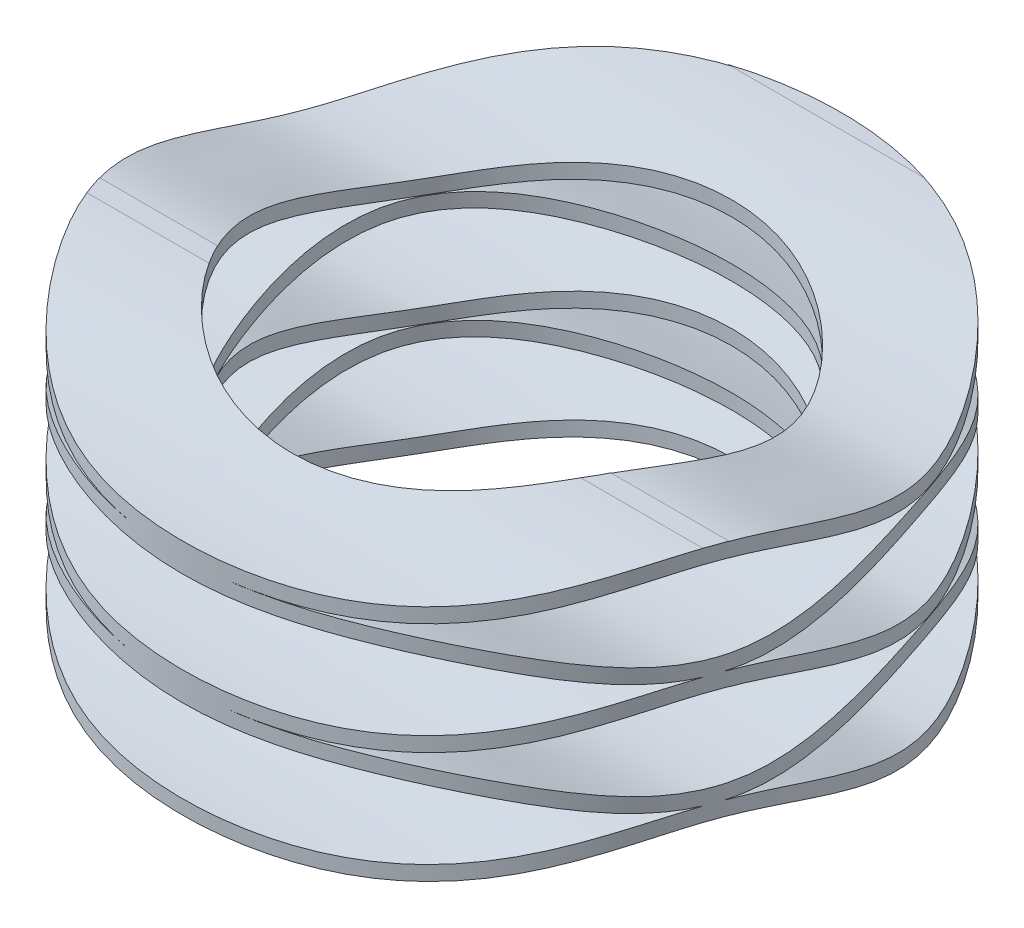
from build123d import *

# Parameters (mm, degrees)
EXTRUDE_THIN1_START       = -4.5
EXTRUDE_THIN1_DEPTH       = 9
BOSS_EXTRUDE2_DEPTH       = 4.5
LPATTERN3_COUNT           = 3
LPATTERN3_PITCH           = 1.016
BOSS_EXTRUDE1_START       = -0.254
BOSS_EXTRUDE1_OUTLINE_W   = 3.81
BOSS_EXTRUDE1_OUTLINE_H   = 0.886
BOSS_EXTRUDE1_OUTLINE_H_2 = 1.648
BOSS_EXTRUDE1_DEPTH       = 0.254
CUT_EXTRUDE1_DEPTH        = 9.775881847
CUT_EXTRUDE1_DEPTH_BACK   = 9.775881847
SKETCH8_OUTSIDE_W         = 13.404
SKETCH8_OUTSIDE_H         = 11.404
SKETCH8_OUTSIDE_R         = 3
SKETCH8_OUTSIDE_R_2       = 2
CUT_EXTRUDE2_DEPTH        = 8.368256101
CUT_EXTRUDE2_DEPTH_BACK   = 8.368256101
SKETCH12_W                = 6.3
SKETCH12_H                = 0.5334


# Read off the part's stored shape, not the designer's step: Extrude-Thin1, Boss-Extrude1
with BuildPart() as part:
    # Extrude-Thin1 outline → Extrude-Thin1 (new body)
    with BuildSketch(Plane(origin=(0, 0, 0), x_dir=(0, 0, -1), z_dir=(1, 0, 0)).offset(EXTRUDE_THIN1_START)):
        with BuildLine():
            Line((6, 0.378649941), (6.5, 0.37865))
            Line((6.5, 0.37865), (6.5, 0.50865))
            Line((6.5, 0.50865), (6, 0.508650057))
            add(Edge.make_bspline(
                [(0, 0.130000057), (0.031255668, 0.129958791), (0.060250148, 0.130722687), (0.120666581, 0.133721045), (0.211463813, 0.140424098), (0.302795129, 0.153114969), (0.48615165, 0.18475664), (0.609309778, 0.214212381), (0.981176685, 0.313261689), (1.232114678, 0.393672394), (1.613586139, 0.47508319), (1.74164001, 0.495650904), (1.999669491, 0.512852073), (2.129613487, 0.507820635), (2.514757352, 0.459828306), (2.76771547, 0.387536187), (3.267679852, 0.245552527), (3.514717016, 0.175846286), (3.879626865, 0.130647832), (3.999717701, 0.12606552), (4.241743288, 0.142157208), (4.363708994, 0.161535002), (4.732275988, 0.239889794), (4.981340354, 0.319226726), (5.359443557, 0.419840511), (5.486269059, 0.450279769), (5.677876083, 0.483521185), (5.741974412, 0.492528476), (5.838475661, 0.501921084), (5.870701477, 0.504365274), (5.935267915, 0.507709169), (5.968753879, 0.508608785), (6, 0.508650057)],
                knots=[0, 0, 0, 0, 0.015625, 0.015625, 0.03125, 0.0625, 0.0625, 0.125, 0.125, 0.25, 0.25, 0.3125, 0.3125, 0.375, 0.375, 0.5, 0.5, 0.625, 0.625, 0.6875, 0.6875, 0.75, 0.75, 0.875, 0.875, 0.9375, 0.9375, 0.96875, 0.96875, 0.984375, 0.984375, 1, 1, 1, 1], degree=3))
            Line((0, 0.130000057), (-0.5, 0.13))
            Line((-0.5, 0.13), (-0.5, 0))
            Line((-0.5, 0), (0, -5.5e-08))
            add(Edge.make_bspline(
                [(0, -5.5e-08), (0.518604966, -0.000660272), (1.022336175, 0.215987121), (1.636469503, 0.347036441), (1.758396337, 0.366483086), (2.000325725, 0.38260359), (2.120360156, 0.377970351), (2.485155411, 0.332507457), (2.732162593, 0.262492218), (3.232198134, 0.120488347), (3.485195597, 0.04851449), (3.870346514, 0.000801373), (4.000277218, -0.004179974), (4.258292807, 0.012966198), (4.386346419, 0.033445512), (5.022149097, 0.168596693), (5.518461749, 0.377989636), (6, 0.378649941)],
                knots=[0, 0, 0, 0, 0.25, 0.25, 0.3125, 0.3125, 0.375, 0.375, 0.5, 0.5, 0.625, 0.625, 0.6875, 0.6875, 0.75, 0.75, 1, 1, 1, 1], degree=3))
        make_face()
    extrude(amount=EXTRUDE_THIN1_DEPTH)

    # Sketch10 → Boss-Extrude2 (add, symmetric)
    with BuildSketch(Plane(origin=(0, 0, 0), x_dir=(0, 0, -1), z_dir=(1, 0, 0))):
        with BuildLine():
            Line((7.4e-08, 0.885994377), (-0.5, 0.886))
            Line((-0.5, 0.886), (-0.5, 1.016))
            Line((-0.5, 1.016), (-6.9e-08, 1.016005411))
            add(Edge.make_bspline(
                [(-6.9e-08, 1.016005411), (0.259209734, 1.019286935), (0.771782174, 0.910334871), (1.519826442, 0.658452483), (2.238146352, 0.601457354), (2.978085723, 0.824485205), (3.73897085, 1.046617307), (4.517540433, 0.986677176), (5.273372288, 0.739812211), (5.752622127, 0.634834593), (6.00043332, 0.6315)],
                knots=[0.000136913, 0.000136913, 0.000136913, 0.000136913, 0.125110591, 0.25008427, 0.375057949, 0.500031628, 0.625005307, 0.749978986, 0.874952665, 0.999926344, 0.999926344, 0.999926344, 0.999926344], degree=3))
            Line((6.00043332, 0.6315), (6.5, 0.6315))
            Line((6.5, 0.6315), (6.5, 0.5015))
            Line((6.5, 0.5015), (5.999999925, 0.501494327))
            add(Edge.make_bspline(
                [(7.4e-08, 0.885994377), (0.24730475, 0.889247641), (0.727083653, 0.787792289), (1.481849123, 0.531808699), (2.261316122, 0.470080559), (3.020533126, 0.702702426), (3.761019865, 0.91534342), (4.482761769, 0.859468169), (5.231853806, 0.616205693), (5.741300675, 0.50491253), (5.999999925, 0.501494327)],
                knots=[-0.000142266, -0.000142266, -0.000142266, -0.000142266, 0.124893434, 0.249929135, 0.374964836, 0.500000536, 0.625036237, 0.750071937, 0.875107638, 1.000143338, 1.000143338, 1.000143338, 1.000143338], degree=3))
        make_face()
    extrude(amount=BOSS_EXTRUDE2_DEPTH, both=True)


with BuildPart() as lpattern3_1:
    # LPattern3: pattern copy
    add(part.part.moved(Location(Vector(0, 1, 0) * (1 * LPATTERN3_PITCH))))


with BuildPart() as lpattern3_2:
    # LPattern3: pattern copy
    add(part.part.moved(Location(Vector(0, 1, 0) * (2 * LPATTERN3_PITCH))))


with BuildPart() as boss_extrude1_tool:
    # Boss-Extrude1 outline → Boss-Extrude1 (new body)
    with BuildSketch(Plane.XY.offset(0.5).offset(BOSS_EXTRUDE1_START)):
        with Locations((0, 0.573)):
            Rectangle(BOSS_EXTRUDE1_OUTLINE_W, BOSS_EXTRUDE1_OUTLINE_H)
        with Locations((0, 1.589)):
            Rectangle(BOSS_EXTRUDE1_OUTLINE_W, BOSS_EXTRUDE1_OUTLINE_H)
        with Locations((0, 2.986)):
            Rectangle(BOSS_EXTRUDE1_OUTLINE_W, BOSS_EXTRUDE1_OUTLINE_H_2)
    extrude(amount=BOSS_EXTRUDE1_DEPTH)


with BuildPart() as part_1:
    add(part.part)


with BuildPart() as part_2:
    # Boss-Extrude1: joined with boss_extrude1_tool
    add(part_1.part.fuse(boss_extrude1_tool.part, lpattern3_1.part, lpattern3_2.part, tol=0.00001))

    # Sketch8 outside → Cut-Extrude1 (cut, two sides: drawn at the far end of the back side and taken through both)
    # profile 1 of 2: a face of its own
    with BuildSketch(Plane(origin=(0, 0, 0), x_dir=(1, 0, 0), z_dir=(0, 1, 0)).offset(-CUT_EXTRUDE1_DEPTH_BACK)):
        with Locations((0, 3)):
            Rectangle(SKETCH8_OUTSIDE_W, SKETCH8_OUTSIDE_H)
        with Locations(Location((0, 3, 0), (0, 0, 270))):
            Circle(SKETCH8_OUTSIDE_R, mode=Mode.SUBTRACT)
    # profile 2 of 2: a face of its own
    with BuildSketch(Plane(origin=(0, 0, 0), x_dir=(1, 0, 0), z_dir=(0, 1, 0)).offset(-CUT_EXTRUDE1_DEPTH_BACK)):
        with Locations(Location((0, 3, 0), (0, 0, 270))):
            Circle(SKETCH8_OUTSIDE_R_2)
    extrude(amount=CUT_EXTRUDE1_DEPTH + CUT_EXTRUDE1_DEPTH_BACK, mode=Mode.SUBTRACT)

    # Sketch12 → Cut-Extrude2 (cut, two sides: drawn at the far end of the back side and taken through both)
    with BuildSketch(Plane(origin=(0, 0, 0), x_dir=(0, 0, -1), z_dir=(1, 0, 0)).offset(-CUT_EXTRUDE2_DEPTH_BACK)):
        with Locations((3, 2.8067)):
            Rectangle(SKETCH12_W, SKETCH12_H)
    extrude(amount=CUT_EXTRUDE2_DEPTH + CUT_EXTRUDE2_DEPTH_BACK, mode=Mode.SUBTRACT)


solid = part_2.part
